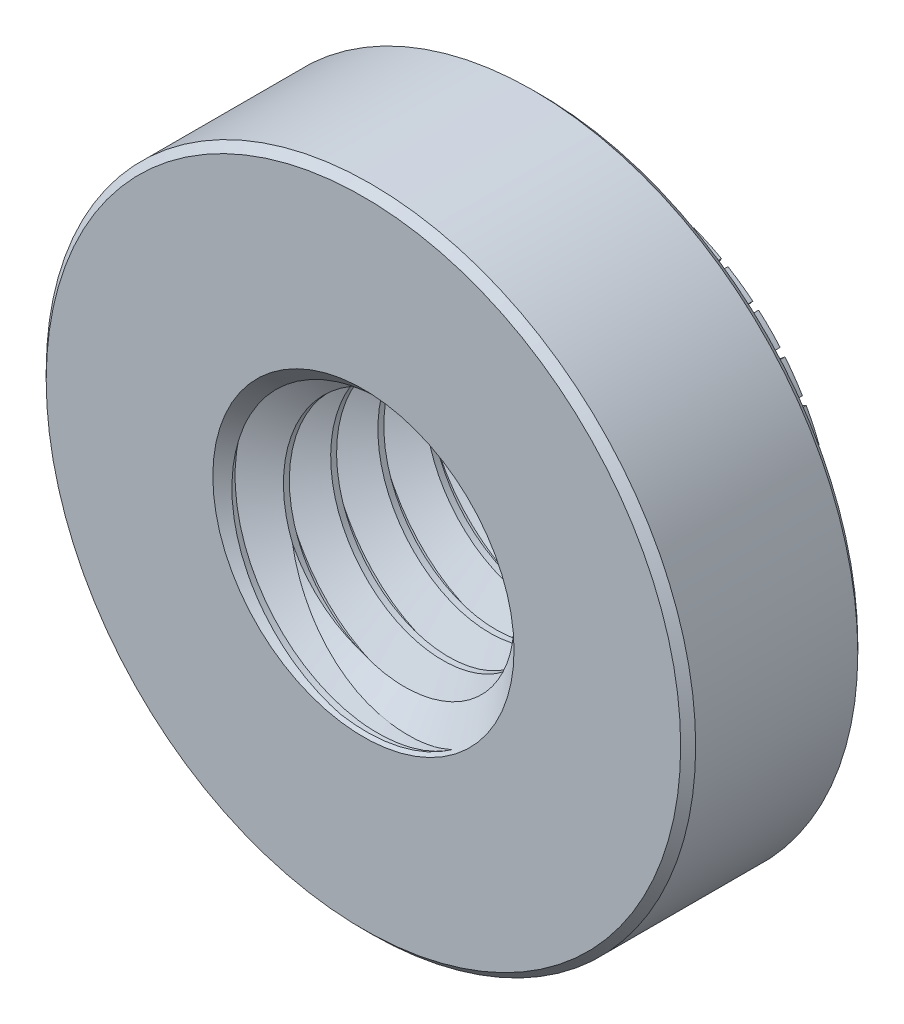
from build123d import *

# Parameters (mm, degrees)
SKETCH1_R               = 5.5
EXTRUDE1_DEPTH          = 3
SKETCH2_R               = 3.685
EXTRUDE2_DEPTH          = 1.53
SKETCH3_W               = 0.127
SKETCH3_H               = 2.0055
CUT_EXTRUDE_THIN1_DEPTH = 1.53
CIRPATTERN1_COUNT       = 36
SKETCH5_OUTSIDE_W       = 16.24
SKETCH5_OUTSIDE_H       = 16.24
SKETCH5_OUTSIDE_R       = 3.2405
CUT_EXTRUDE1_DEPTH      = 0.254
CHAMFER1_SIZE           = 0.127
SKETCH6_R               = 5.5
SKETCH6_R_2             = 3.2405
CUT_EXTRUDE2_DEPTH      = 0.127
CHAMFER2_SIZE           = 0.127
SKETCH7_R               = 2.5
CUT_EXTRUDE3_DEPTH      = 10.001161036
SWEEP1_PITCH            = 0.8
SKETCH10_R              = 5.373
CUT_EXTRUDE4_DEPTH      = 10.373084487
SKETCH11_R              = 3.1135
CUT_EXTRUDE5_DEPTH      = 10.001161087


with BuildPart() as part:
    # Sketch1 → Extrude1 (new body)
    with BuildSketch(Plane.XY):
        Circle(SKETCH1_R)
    extrude(amount=-EXTRUDE1_DEPTH)

    # Sketch2 → Extrude2 (add)
    with BuildSketch(Plane(origin=(0, 0, -3), x_dir=(-1, 0, 0), z_dir=(0, 0, -1))):
        with Locations(Location((0, 0, 0), (0, 0, 180))):
            Circle(SKETCH2_R)
    extrude(amount=EXTRUDE2_DEPTH)

    # Sketch3 → Cut-Extrude-Thin1 (cut)
    with BuildSketch(Plane(origin=(0, 0, -4.53), x_dir=(-1, 0, 0), z_dir=(0, 0, -1))):
        with Locations((0, 4.49725)):
            Rectangle(SKETCH3_W, SKETCH3_H)
    cut_extrude_thin1 = extrude(amount=-CUT_EXTRUDE_THIN1_DEPTH, mode=Mode.SUBTRACT)

    # CirPattern1: Cut-Extrude-Thin1 ×36 about axis
    cirpattern1_axis = Axis((0, 0, 0), (0, 0, 1))
    for i in range(1, CIRPATTERN1_COUNT):
        add(cut_extrude_thin1.rotate(cirpattern1_axis, i * 360 / CIRPATTERN1_COUNT), mode=Mode.SUBTRACT)

    # Sketch5 outside → Cut-Extrude1 (cut)
    with BuildSketch(Plane(origin=(0, 0, -4.53), x_dir=(-1, 0, 0), z_dir=(0, 0, -1))):
        Rectangle(SKETCH5_OUTSIDE_W, SKETCH5_OUTSIDE_H)
        Circle(SKETCH5_OUTSIDE_R, mode=Mode.SUBTRACT)
    extrude(amount=-CUT_EXTRUDE1_DEPTH, mode=Mode.SUBTRACT)

    # Chamfer1
    chamfer1_edges = [part.edges().sort_by_distance(p)[0] for p in [
        (3.2405, 0, -4.53),
    ]]
    chamfer(chamfer1_edges, length=CHAMFER1_SIZE)

    # Sketch6 → Cut-Extrude2 (cut)
    with BuildSketch(Plane(origin=(0, 0, -3), x_dir=(-1, 0, 0), z_dir=(0, 0, -1))):
        with Locations(Location((0, 0, 0), (0, 0, 180))):
            Circle(SKETCH6_R)
        Circle(SKETCH6_R_2, mode=Mode.SUBTRACT)
    extrude(amount=CUT_EXTRUDE2_DEPTH, mode=Mode.SUBTRACT)

    # Chamfer2
    chamfer2_edges = [part.edges().sort_by_distance(p)[0] for p in [
        (-5.5, 0, 0),
        (-5.5, 0, -3),
    ]]
    chamfer(chamfer2_edges, length=CHAMFER2_SIZE)

    # Sketch7 → Cut-Extrude3 (cut, through all)
    with BuildSketch(Plane.XY):
        Circle(SKETCH7_R)
    extrude(amount=-CUT_EXTRUDE3_DEPTH, mode=Mode.SUBTRACT)

    # Sweep1: the profile of Sketch9 profile screwed along a right-hand helix of 7.5 turns, 6 arcs to a turn; built about Z, then put on its axis
    sweep1_z = Axis((0, 0, 0), (0, 0, 1))
    sweep1_corners = [(2.5003, 0, -0.700173205), (1.980384758, 0, -0.4), (1.980384758, 0, -0.3), (2.5003, 0, 0.000173205)]
    with BuildLine(mode=Mode.PRIVATE) as sweep1_profile:
        Line(sweep1_corners[0], sweep1_corners[1])
        Line(sweep1_corners[1], sweep1_corners[2])
        Line(sweep1_corners[2], sweep1_corners[3])
        Line(sweep1_corners[3], sweep1_corners[0])
    sweep1_cap = Face(sweep1_profile.wire())
    sweep1_turn_angles = [0, 30, 60, 90, 120, 150, 180, 210, 240, 270, 300, 330, 360]
    sweep1_turn_weights = [1, 0.8660254037844387, 1, 0.8660254037844387, 1, 0.8660254037844387, 1, 0.8660254037844387, 1, 0.8660254037844387, 1, 0.8660254037844387, 1]
    sweep1_turn_rails = [Edge.make_bspline([Vector(p[0], p[1], 0).rotate(sweep1_z, sweep1_turn_angles[k]) / sweep1_turn_weights[k] + Vector(0, 0, p[2] + SWEEP1_PITCH * sweep1_turn_angles[k] / 360) for k in range(13)], [0, 0, 0, 1, 1, 2, 2, 3, 3, 4, 4, 5, 5, 6, 6, 6], 2, sweep1_turn_weights) for p in sweep1_corners]
    sweep1_turn_sides = [Face.make_surface_from_curves(sweep1_turn_rails[p[0]], sweep1_turn_rails[p[1]]) for p in [(0, 1), (1, 2), (2, 3), (3, 0)]]
    sweep1_last_angles = [2520, 2550, 2580, 2610, 2640, 2670, 2700]
    sweep1_last_weights = [1, 0.8660254037844387, 1, 0.8660254037844387, 1, 0.8660254037844267, 1]
    sweep1_last_rails = [Edge.make_bspline([Vector(p[0], p[1], 0).rotate(sweep1_z, sweep1_last_angles[k]) / sweep1_last_weights[k] + Vector(0, 0, p[2] + SWEEP1_PITCH * sweep1_last_angles[k] / 360) for k in range(7)], [0, 0, 0, 1, 1, 2, 2, 3, 3, 3], 2, sweep1_last_weights) for p in sweep1_corners]
    sweep1_last_sides = [Face.make_surface_from_curves(sweep1_last_rails[p[0]], sweep1_last_rails[p[1]]) for p in [(0, 1), (1, 2), (2, 3), (3, 0)]]
    sweep1 = Plane(origin=(0, 0, -4.53), x_dir=(0, 1, 0), z_dir=(0, 0, 1)) * Solid(Shell([*[p.moved(Location((0, 0, SWEEP1_PITCH * i))) for i in range(7) for p in sweep1_turn_sides], *sweep1_last_sides, sweep1_cap, sweep1_cap.rotate(sweep1_z, 2700).moved(Location((0, 0, SWEEP1_PITCH * 2700 / 360)))]))
    add(sweep1)

    # Sketch10 → Cut-Extrude4 (cut, through all)
    with BuildSketch(Plane.XY):
        Circle(SKETCH10_R)
    extrude(amount=CUT_EXTRUDE4_DEPTH, mode=Mode.SUBTRACT)

    # Sketch11 → Cut-Extrude5 (cut, through all)
    with BuildSketch(Plane(origin=(0, 0, -4.53), x_dir=(-1, 0, 0), z_dir=(0, 0, -1))):
        Circle(SKETCH11_R)
    extrude(amount=CUT_EXTRUDE5_DEPTH, mode=Mode.SUBTRACT)

    # Cut-Extrude6 cone 1 section (through the dimple's axis) → Cut-Extrude6 (revolve, cut)
    with BuildSketch(Plane(origin=(0, 0, 0), x_dir=(0, -1, 0), z_dir=(1, 0, 0))):
        Polygon((0, 0), (2.5508, 0), (0, 2.5508), align=None)
    revolve(axis=Axis((0, 0, 0), (0, 0, -1)), mode=Mode.SUBTRACT)

    # Cut-Extrude7 cone 1 section (through the dimple's axis) → Cut-Extrude7 (revolve, cut)
    with BuildSketch(Plane(origin=(0, 0, -4.53), x_dir=(0, 1, 0), z_dir=(1, 0, 0))):
        Polygon((0, 0), (2.5508, 0), (0, 2.5508), align=None)
    revolve(axis=Axis((0, 0, -4.53), (0, 0, 1)), mode=Mode.SUBTRACT)


solid = part.part
